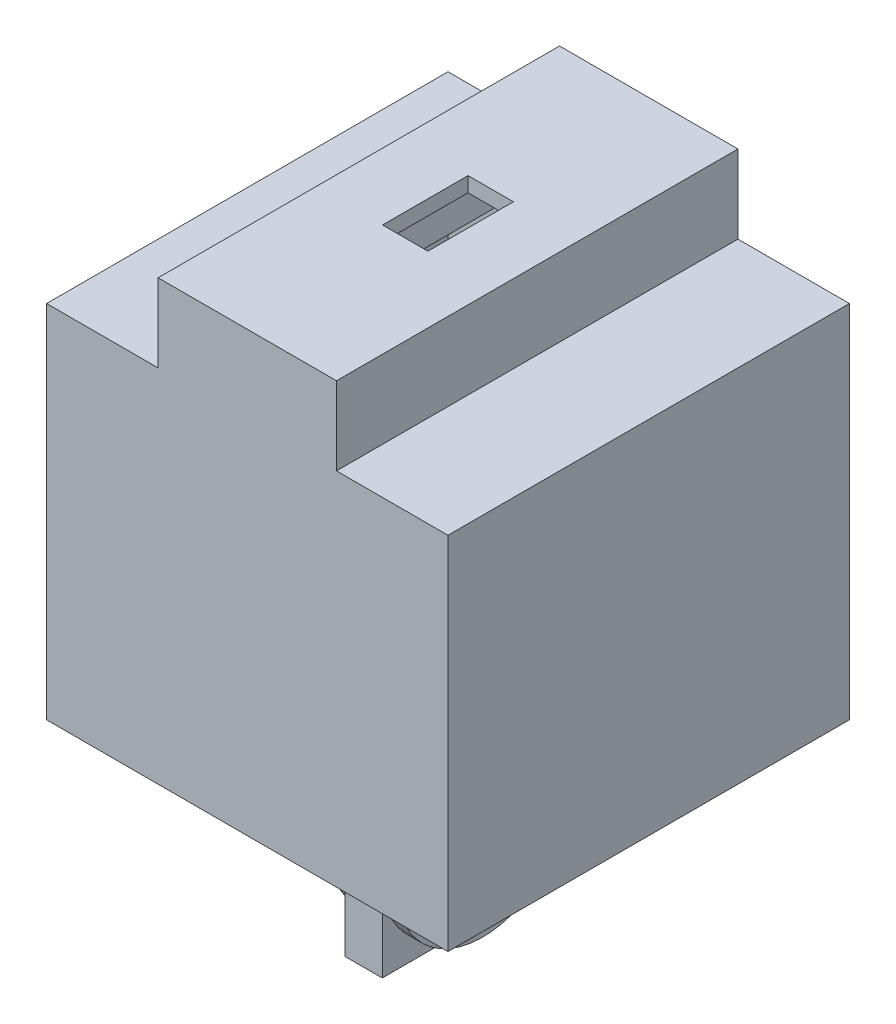
from build123d import *

# Parameters (mm, degrees)
SKETCH_1_W          = 100
SKETCH_1_H          = 110
EXTRUDE_1_DEPTH     = 100
SKETCH_2_W          = 30
SKETCH_2_H          = 21
CUT_EXTRUDE_1_DEPTH = 100
EXTRUDE_START       = -100
EXTRUDE_3_DEPTH     = 100
EXTRUDE_2_DEPTH     = 4
EXTRUDE_3_2_DEPTH   = 4
SKETCH_4_W          = 6.1
SKETCH_4_H          = 11.5
CUT_EXTRUDE_4_DEPTH = 4
SKETCH_6_W          = 10
SKETCH_6_H          = 45.995714962
EXTRUDE_4_DEPTH     = 46
SKETCH_7_R          = 22.997857481
EXTRUDE_5_DEPTH     = 4
EXTRUDE_START_2     = 4
SKETCH_8_R          = 22.997857481
EXTRUDE_6_DEPTH     = 4


# Read off the part's stored shape, not the designer's step: 拉伸-薄壁3
with BuildPart() as part:
    # 草图1 → 凸台-拉伸1 (new body)
    with BuildSketch(Plane.XY):
        Polygon((-4, 0), (-4, 114), (104, 114), (104, -4), (-4, -4), align=None)
        with Locations((50, 55)):
            Rectangle(SKETCH_1_W, SKETCH_1_H, mode=Mode.SUBTRACT)
    extrude(amount=EXTRUDE_1_DEPTH)

    # 草图2 → 切除-拉伸1 (cut)
    with BuildSketch(Plane.XY.offset(100)):
        with Locations((11, 103.5)):
            Rectangle(SKETCH_2_W, SKETCH_2_H)
    cut_extrude_1 = extrude(amount=-CUT_EXTRUDE_1_DEPTH, mode=Mode.SUBTRACT)

    # Extrude 3 outline → Extrude 3 (add)
    with BuildSketch(Plane.XY.offset(100).offset(EXTRUDE_START)):
        Polygon((74, 110), (70, 110), (70, 89), (100, 89), (100, 93), (74, 93), align=None)
        Polygon((26, 93), (0, 93), (0, 89), (30, 89), (30, 110), (26, 110), align=None)
    extrude(amount=EXTRUDE_3_DEPTH)

    # 镜向1: 切除-拉伸1 across plane
    add(cut_extrude_1.mirror(Plane(origin=(50, 0, 0), x_dir=(0, 0, 1), z_dir=(1, 0, 0))), mode=Mode.SUBTRACT)

    # 草图3<3> → 凸台-拉伸2 (add)
    with BuildSketch(Plane.XY.offset(100)):
        Polygon((26, 93), (-4, 93), (-4, -4), (104, -4), (104, 93), (74, 93), (74, 114), (26, 114), align=None)
    extrude(amount=EXTRUDE_2_DEPTH)

    # 草图3<4> → Extrude 3 2 (add)
    with BuildSketch(Plane.XY.offset(100).offset(EXTRUDE_START)):
        Polygon((26, 93), (-4, 93), (-4, -4), (104, -4), (104, 93), (74, 93), (74, 114), (26, 114), align=None)
    extrude(amount=-EXTRUDE_3_2_DEPTH)

    # 草图4 → 切除-拉伸4 (cut)
    with BuildSketch(Plane(origin=(0, 114, 0), x_dir=(1, 0, 0), z_dir=(0, 1, 0))):
        with Locations((46.95, -44.25)):
            Rectangle(SKETCH_4_W, SKETCH_4_H)
        with Locations((53.05, -44.25)):
            Rectangle(SKETCH_4_W, SKETCH_4_H)
        with Locations((46.95, -55.75)):
            Rectangle(SKETCH_4_W, SKETCH_4_H)
        with Locations((53.05, -55.75)):
            Rectangle(SKETCH_4_W, SKETCH_4_H)
    extrude(amount=-CUT_EXTRUDE_4_DEPTH, mode=Mode.SUBTRACT)

    # 草图6 → 凸台-拉伸4 (add)
    with BuildSketch(Plane.XZ.offset(4)):
        with Locations((50.313928752, 50)):
            Rectangle(SKETCH_6_W, SKETCH_6_H)
    extrude(amount=EXTRUDE_4_DEPTH)

    # 草图7 → 凸台-拉伸5 (add)
    with BuildSketch(Plane(origin=(55.313928752, 0, 0), x_dir=(0, 0, -1), z_dir=(1, 0, 0))):
        with Locations((-50, -27)):
            Circle(SKETCH_7_R)
    extrude(amount=EXTRUDE_5_DEPTH)

    # 草图8 → 凸台-拉伸6 (add)
    with BuildSketch(Plane.ZY.offset(-45.313928752).offset(EXTRUDE_START_2)):
        with Locations(Location((50, -27, 0), (0, 0, 180))):
            Circle(SKETCH_8_R)
    extrude(amount=-EXTRUDE_6_DEPTH)


solid = part.part
